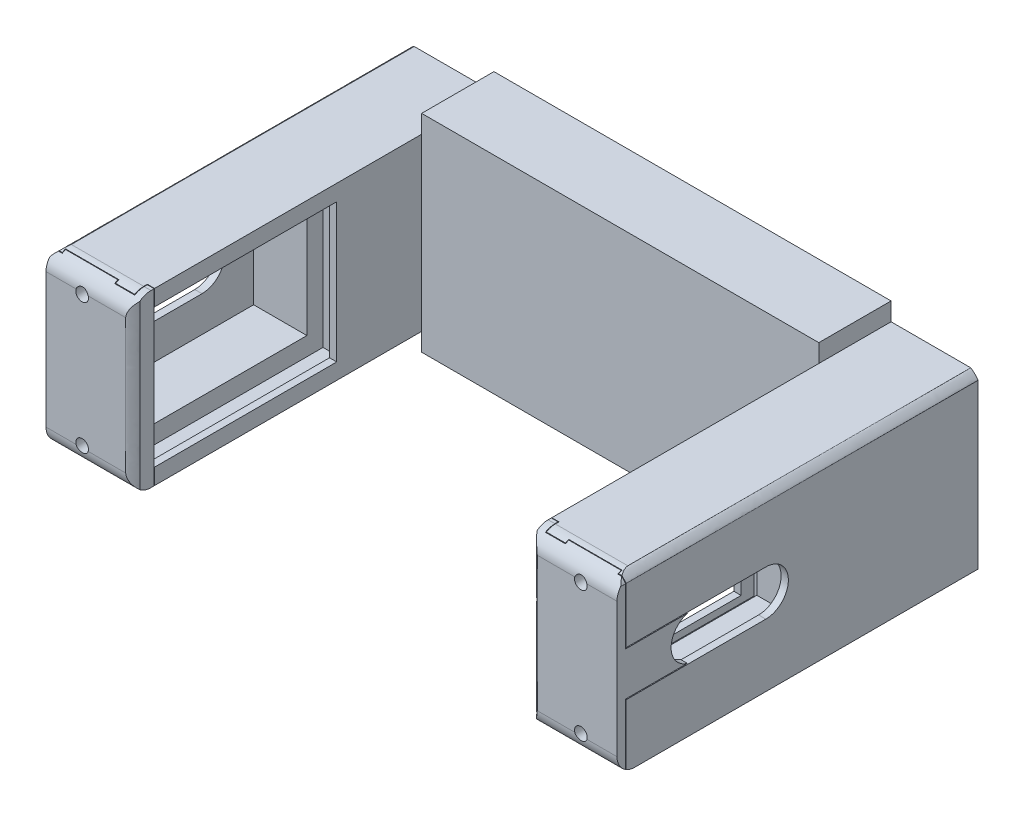
from build123d import *

# Parameters (mm, degrees)
BODYEXTRUDE_DEPTH               = 114.8
BODYEXTRUDE_2_DEPTH             = 114.8
SKETCH2_W                       = 48.1
SKETCH2_H                       = 94.5
BACKFACE_DEPTH                  = 80
SKETCH8_W                       = 8.9
SKETCH8_H                       = 64.2
INNERFILL_DEPTH                 = 29.5
SKETCH9_W                       = 114.8
SKETCH9_H                       = 23
WIRESIDEFILL_DEPTH              = 4
SKETCH10_W                      = 48.1
SKETCH10_H                      = 94.5
FRONTFACE_DEPTH                 = 5
SKETCH11_R                      = 12.5
WIREHOLES_DEPTH                 = 152.842459477
SKETCH12_W                      = 4
SKETCH12_H                      = 7
FRONTSIDEFILL_DEPTH             = 76.8
FRONTFILLET_R                   = 10
SIDEFILLETS_SIZE                = 4
CUT_THICKEN1_START              = -48
CUT_THICKEN1_DEPTH              = 96
SKETCH18_W                      = 28
SKETCH18_H                      = 63.2
BOSS_EXTRUDE1_DEPTH             = 10
CUT_THICKEN3_START              = 12
CUT_THICKEN3_OUTLINE_W          = 4
CUT_THICKEN3_OUTLINE_H          = 41
CUT_THICKEN3_DEPTH              = 0.5
CUT_THICKEN4_START              = 16.45
CUT_THICKEN4_OUTLINE_W          = 4
CUT_THICKEN4_OUTLINE_H          = 24.5
CUT_THICKEN4_DEPTH              = 40.95
CUT_THICKEN4_START_2            = 16.4
CUT_THICKEN4_2_OUTLINE_W        = 4
CUT_THICKEN4_2_OUTLINE_H        = 0.5
CUT_THICKEN4_2_DEPTH            = 3.354248802
CUT_THICKEN4_START_3            = -187.998618122
CUT_THICKEN4_3_DEPTH            = 4
SKETCH67_W                      = 42.476182723
SKETCH67_H                      = 25
CUT_EXTRUDE24_DEPTH             = 4
SKETCH21_W                      = 4
SKETCH21_H                      = 24
MERGEEXTRUDE_DEPTH              = 0.3
SKETCH22_R                      = 3.5
CUT_EXTRUDE1_DEPTH              = 6.5
HORIZONTALPLATFORM_W            = 40
HORIZONTALPLATFORM_H            = 114.5
HORIZONTALPLATFORMEXTRUDE_DEPTH = 109.898618122


with BuildPart() as part:
    # Sketch1 → BodyExtrude (new body)
    with BuildSketch(Plane(origin=(0, 0, -57.4), x_dir=(-1, 0, 0), z_dir=(0, 0, -1))):
        Polygon((183.998618122, 11.5), (183.998618122, 32.1), (154.498618122, 32.1), (154.498618122, 42.25), (143.898618122, 42.25), (143.898618122, 38.4), (139.898618122, 38.4), (139.898618122, 47.25), (187.998618122, 47.25), (187.998618122, 11.5), align=None)
    extrude(amount=-BODYEXTRUDE_DEPTH)

    # Sketch2 → BackFace (add)
    with BuildSketch(Plane(origin=(0, 0, -57.4), x_dir=(-1, 0, 0), z_dir=(0, 0, -1))):
        with Locations((163.948618122, 0)):
            Rectangle(SKETCH2_W, SKETCH2_H)
    extrude(amount=BACKFACE_DEPTH)



with BuildPart() as body_2:
    # Sketch1 → BodyExtrude 2 (new body)
    with BuildSketch(Plane(origin=(0, 0, -57.4), x_dir=(-1, 0, 0), z_dir=(0, 0, -1))):
        Polygon((139.898618122, -47.25), (187.998618122, -47.25), (187.998618122, -11.5), (183.998618122, -11.5), (183.998618122, -32.1), (154.498618122, -32.1), (154.498618122, -42.25), (143.898618122, -42.25), (143.898618122, -38.4), (139.898618122, -38.4), align=None)
    extrude(amount=-BODYEXTRUDE_2_DEPTH)


with BuildPart() as body_3:
    # Sketch8 → innerFill (new body)
    with BuildSketch(Plane(origin=(-183.998618122, 0, 0), x_dir=(0, 0, -1), z_dir=(1, 0, 0))):
        with Locations((52.95, 0)):
            Rectangle(SKETCH8_W, SKETCH8_H)
    extrude(amount=INNERFILL_DEPTH)


with BuildPart() as part_1:
    add(part.part)

    add(body_2.part)  # WireSideFill merges body 2

    add(body_3.part)  # WireSideFill merges body 3
    # Sketch9 → WireSideFill (add)
    with BuildSketch(Plane.ZY.offset(187.998618122)):
        Rectangle(SKETCH9_W, SKETCH9_H)
    extrude(amount=-WIRESIDEFILL_DEPTH)

    # Sketch10 → FrontFace (add)
    with BuildSketch(Plane.XY.offset(57.4)):
        with Locations((-163.948618122, 0)):
            Rectangle(SKETCH10_W, SKETCH10_H)
    extrude(amount=FRONTFACE_DEPTH)

    # Sketch11 → WireHoles (cut, through all)
    with BuildSketch(Plane(origin=(-183.998618122, 0, 0), x_dir=(0, 0, -1), z_dir=(1, 0, 0))):
        with Locations((-19.95, 0)):
            Circle(SKETCH11_R)
        with Locations((19.95, 0)):
            Circle(SKETCH11_R)
    extrude(amount=-WIREHOLES_DEPTH, mode=Mode.SUBTRACT)

    # Sketch12 → FrontSideFill (add)
    with BuildSketch(Plane.XZ.offset(-38.4)):
        with Locations((-141.898618122, -53.9)):
            Rectangle(SKETCH12_W, SKETCH12_H)
        with Locations((-141.898618122, 53.9)):
            Rectangle(SKETCH12_W, SKETCH12_H)
    extrude(amount=FRONTSIDEFILL_DEPTH)

    # FrontFillet
    frontfillet_edges = [part_1.edges().sort_by_distance(p)[0] for p in [
        (-163.948618122, -47.25, 62.4),
        (-163.948618122, 47.25, 62.4),
    ]]
    fillet(frontfillet_edges, radius=FRONTFILLET_R)

    # SideFillets
    # a fillet whose section is not a circle: 4 mm, written as the material it takes off along each edge
    with BuildSketch(Plane(origin=(-139.898618122, 47.25, 62.4), x_dir=(-1, 0, 0), z_dir=(0, -1, 0))) as sidefillets_piece_1:
        with BuildLine():
            Bezier((SIDEFILLETS_SIZE, 0), (0, 0), (0, SIDEFILLETS_SIZE), weights=[1, 0.111111111, 1])
            Line((0, SIDEFILLETS_SIZE), (0, 0))
            Line((0, 0), (SIDEFILLETS_SIZE, 0))
        make_face()
    extrude(amount=94.5, mode=Mode.SUBTRACT)
    with BuildSketch(Plane(origin=(-187.998618122, 47.25, -147.4), x_dir=(0, -1, 0), z_dir=(0, 0, 1))) as sidefillets_piece_2:
        with BuildLine():
            Bezier((SIDEFILLETS_SIZE, 0), (0, 0), (0, SIDEFILLETS_SIZE), weights=[1, 0.111111111, 1])
            Line((0, SIDEFILLETS_SIZE), (0, 0))
            Line((0, 0), (SIDEFILLETS_SIZE, 0))
        make_face()
    extrude(amount=209.8, mode=Mode.SUBTRACT)

    # Cut-Thicken1: read off the stored shape, not the designer's step
    # Cut-Thicken1 outline → Cut-Thicken1 (cut)
    with BuildSketch(Plane(origin=(0, 0, 0), x_dir=(1, 0, 0), z_dir=(0, 1, 0)).offset(CUT_THICKEN1_START)):
        Polygon((-187.998618122, -57.65), (-183.748618122, -57.65), (-183.748618122, -55.814087575), (-154.748618122, -55.814087575), (-154.748618122, -57.65), (-143.648618122, -57.65), (-143.648618122, -50.65), (-139.898618122, -50.65), (-139.898618122, -50.4), (-143.898618122, -50.4), (-143.898618122, -57.4), (-154.498618122, -57.4), (-154.498618122, -55.564087575), (-183.998618122, -55.564087575), (-183.998618122, -57.4), (-187.998618122, -57.4), align=None)
    extrude(amount=CUT_THICKEN1_DEPTH, mode=Mode.SUBTRACT)

    # Sketch18 → Boss-Extrude1 (add)
    with BuildSketch(Plane(origin=(0, 0, 57.4), x_dir=(-1, 0, 0), z_dir=(0, 0, -1))):
        with Locations((168.748618122, 0)):
            Rectangle(SKETCH18_W, SKETCH18_H)
    extrude(amount=BOSS_EXTRUDE1_DEPTH)

    # Cut-Thicken3: read off the stored shape, not the designer's step
    # Cut-Thicken3 outline → Cut-Thicken3 (cut)
    with BuildSketch(Plane(origin=(0, 0, 0), x_dir=(1, 0, 0), z_dir=(0, 1, 0)).offset(CUT_THICKEN3_START)):
        with Locations((-185.998618122, -36.9)):
            Rectangle(CUT_THICKEN3_OUTLINE_W, CUT_THICKEN3_OUTLINE_H)
    extrude(amount=CUT_THICKEN3_DEPTH, mode=Mode.SUBTRACT)

    # Cut-Thicken4: read off the stored shape, not the designer's step
    # Cut-Thicken4 outline → Cut-Thicken4 (cut)
    with BuildSketch(Plane.XY.offset(CUT_THICKEN4_START)):
        with Locations((-185.998618122, -0.25)):
            Rectangle(CUT_THICKEN4_OUTLINE_W, CUT_THICKEN4_OUTLINE_H)
    extrude(amount=CUT_THICKEN4_DEPTH, mode=Mode.SUBTRACT)

    # Cut-Thicken4 2 outline → Cut-Thicken4 2 (cut)
    with BuildSketch(Plane.XY.offset(CUT_THICKEN4_START_2)):
        with Locations((-185.998618122, -12.25)):
            Rectangle(CUT_THICKEN4_2_OUTLINE_W, CUT_THICKEN4_2_OUTLINE_H)
    extrude(amount=CUT_THICKEN4_2_DEPTH, mode=Mode.SUBTRACT)

    # Sketch67 → Cut-Extrude24 (cut)
    with BuildSketch(Plane.ZY.offset(187.998618122)):
        with Locations((1.288091361, 0)):
            Rectangle(SKETCH67_W, SKETCH67_H)
    extrude(amount=-CUT_EXTRUDE24_DEPTH, mode=Mode.SUBTRACT)


with BuildPart() as body_2_2:
    # Cut-Thicken4 3 outline → Cut-Thicken4 3 (new body)
    with BuildSketch(Plane.YZ.offset(CUT_THICKEN4_START_3)):
        with BuildLine():
            Line((12, 23.45), (12, 57.4))
            Line((12, 57.4), (-12, 57.4))
            Line((-12, 57.4), (-12, 23.45))
            ThreePointArc((-12, 23.45), (0, 32.45), (12, 23.45))
        make_face()
    extrude(amount=CUT_THICKEN4_3_DEPTH)

    # Sketch21 → MergeExtrude (add)
    with BuildSketch(Plane.XY.offset(57.4)):
        with Locations((-185.998618122, 0)):
            Rectangle(SKETCH21_W, SKETCH21_H)
    extrude(amount=MERGEEXTRUDE_DEPTH)

    # Combine2: union part
    add(part_1.part)

    # Sketch22 → Cut-Extrude1 (cut)
    with BuildSketch(Plane.XY.offset(62.4)):
        with Locations((-167.998618122, 36.25)):
            Circle(SKETCH22_R)
        with Locations(Location((-167.998618122, -36.25, 0), (0, 0, 343.398450401))):
            Circle(SKETCH22_R)
    extrude(amount=-CUT_EXTRUDE1_DEPTH, mode=Mode.SUBTRACT)

    # HorizontalPlatform → HorizontalPlatformExtrude (add)
    with BuildSketch(Plane(origin=(-139.898618122, 0, 0), x_dir=(0, 0, -1), z_dir=(1, 0, 0))):
        with Locations((117.4, 0)):
            Rectangle(HORIZONTALPLATFORM_W, HORIZONTALPLATFORM_H)
    extrude(amount=HORIZONTALPLATFORMEXTRUDE_DEPTH)


with BuildPart() as body_2_3:
    # Mirror2: mirrored copy
    add(body_2_2.part.mirror(Plane(origin=(-30, 0.35, 0), x_dir=(0, 0, 1), z_dir=(1, 0, 0))))

    # Combine3: union body 2 2
    add(body_2_2.part)


solid = body_2_3.part
